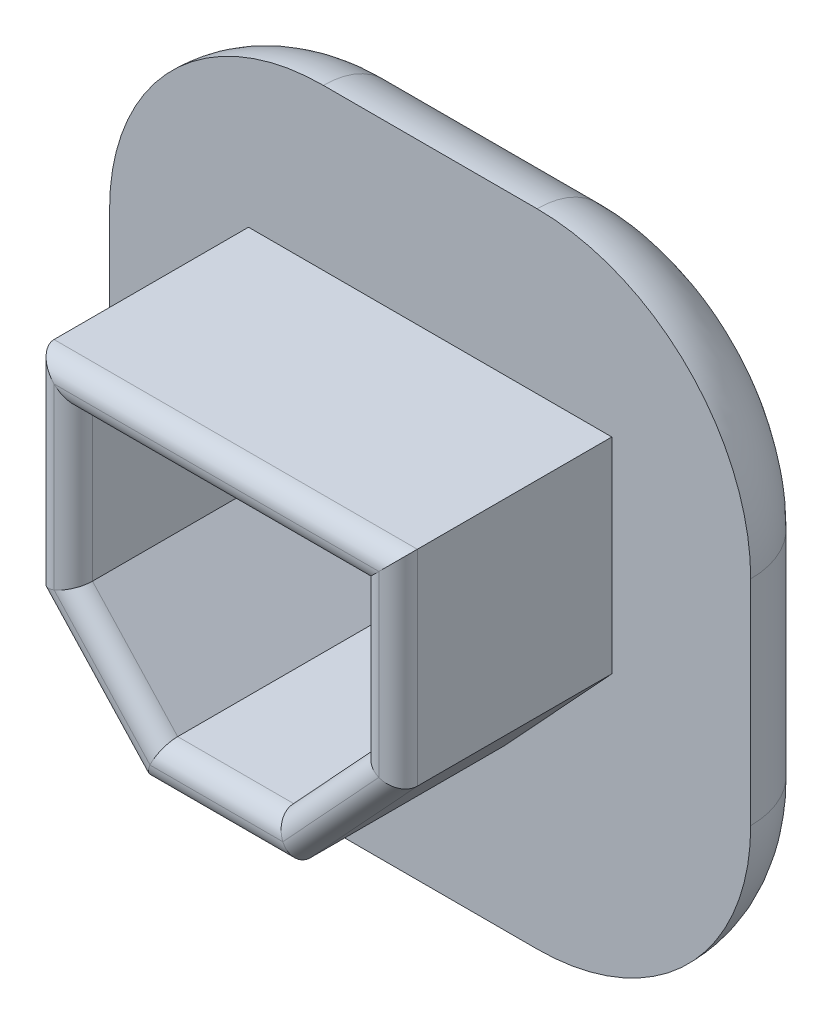
from build123d import *

# Parameters (mm, degrees)
SKETCH1_W           = 15
SKETCH1_H           = 15
BOSS_EXTRUDE1_DEPTH = 2
FILLET11_R          = 5
FILLET13_R          = 2
SKETCH7_W           = 8.5
SKETCH7_H           = 7.5
BOSS_EXTRUDE5_DEPTH = 5
CUT_EXTRUDE3_DEPTH  = 5
SHELL8_T            = -0.9
FILLET15_R          = 0.45


with BuildPart() as part:
    # Sketch1 → Boss-Extrude1 (new body)
    with BuildSketch(Plane.XY):
        Rectangle(SKETCH1_W, SKETCH1_H)
    extrude(amount=BOSS_EXTRUDE1_DEPTH)

    # Fillet11
    fillet11_edges = [part.edges().sort_by_distance(p)[0] for p in [
        (7.5, -7.5, 1),
        (-7.5, -7.5, 1),
        (-7.5, 7.5, 1),
        (7.5, 7.5, 1),
    ]]
    fillet(fillet11_edges, radius=FILLET11_R)

    # Fillet13
    fillet13_edges = [part.edges().sort_by_distance(p)[0] for p in [
        (6.035533906, 6.035533906, 0),
        (0, 7.5, 0),
        (-6.035533906, 6.035533906, 0),
        (-7.5, 0, 0),
        (-6.035533906, -6.035533906, 0),
        (0, -7.5, 0),
        (6.035533906, -6.035533906, 0),
        (7.5, 0, 0),
    ]]
    fillet(fillet13_edges, radius=FILLET13_R - 0.0001)  # a hair under: the kernel refuses the full size

    # Sketch7 → Boss-Extrude5 (add)
    with BuildSketch(Plane.XY.offset(2)):
        Rectangle(SKETCH7_W, SKETCH7_H)
    extrude(amount=BOSS_EXTRUDE5_DEPTH)

    # Sketch8 → Cut-Extrude3 (cut)
    with BuildSketch(Plane.XY.offset(7)):
        Polygon((-4.25, -1.05), (-1.75, -3.75), (-4.25, -3.75), align=None)
        Polygon((4.25, -1.05), (1.75, -3.75), (4.25, -3.75), align=None)
    extrude(amount=-CUT_EXTRUDE3_DEPTH, mode=Mode.SUBTRACT)

    # Shell8
    shell8_openings = [part.faces().sort_by_distance(p)[0] for p in [
        (0, 0.3375, 7),
    ]]
    offset(amount=SHELL8_T, openings=shell8_openings, kind=Kind.INTERSECTION)

    # Fillet15
    fillet15_edges = [part.edges().sort_by_distance(p)[0] for p in [
        (0, 2.85, 7),
        (2.353387684, -1.773658698, 7),
        (-2.353387684, -1.773658698, 7),
        (0, 3.75, 7),
        (-4.25, 1.35, 7),
        (4.25, 1.35, 7),
        (0, -3.75, 7),
        (-3, -2.4, 7),
        (3, -2.4, 7),
        (-3.35, 1.076341302, 7),
        (0, -2.85, 7),
        (3.35, 1.076341302, 7),
    ]]
    fillet(fillet15_edges, radius=FILLET15_R - 0.0001)  # a hair under: the kernel refuses the full size


solid = part.part
